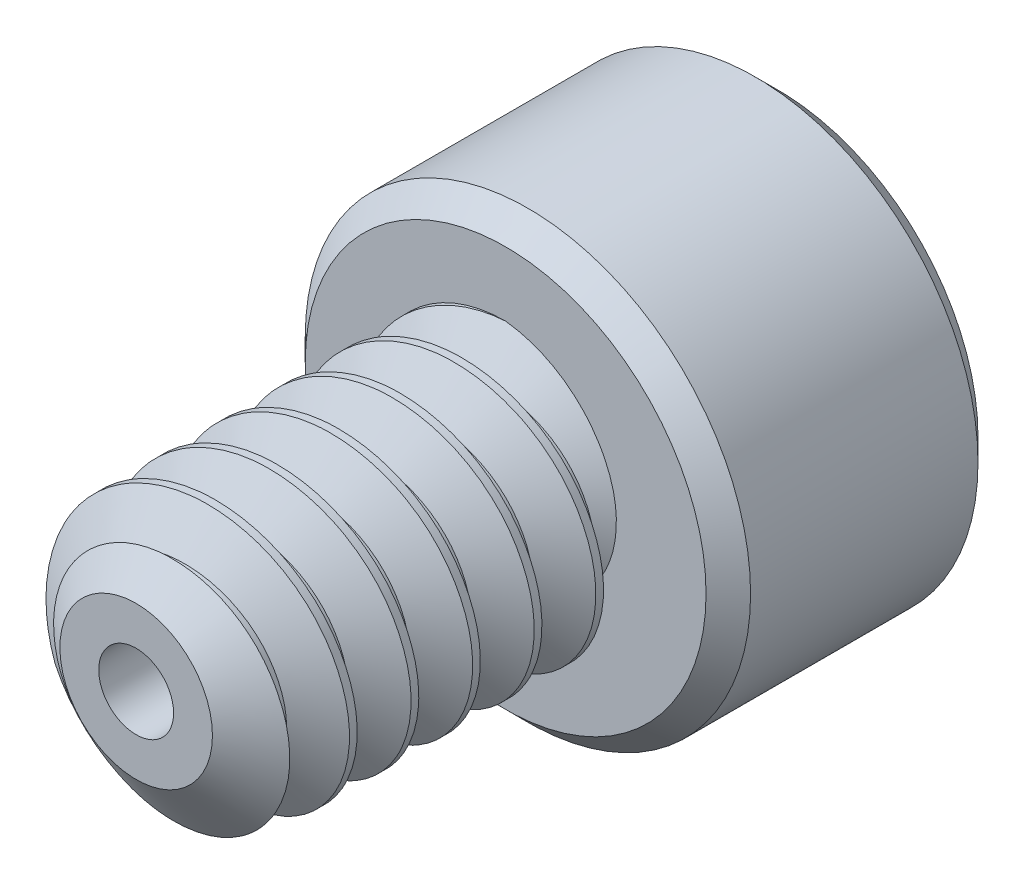
from build123d import *

# Parameters (mm, degrees)
SKETCH1_R          = 1.7526
EXTRUDE1_DEPTH     = 4.7625
CUT_SWEEP1_PITCH   = 0.79375
SKETCH6_R          = 2.8702
EXTRUDE2_DEPTH     = 3.5052
CUT_EXTRUDE1_DEPTH = 2.08359375
CHAMFER1_SIZE      = 0.28702
SKETCH11_R         = 0.4826
CUT_EXTRUDE3_DEPTH = 10.21037238


with BuildPart() as part:
    # Sketch1 → Extrude1 (new body)
    with BuildSketch(Plane.XY):
        Circle(SKETCH1_R)
    extrude(amount=-EXTRUDE1_DEPTH)

    # Cut-Sweep1: the profile of Sketch3 profile screwed along a right-hand helix of 7 turns, 6 arcs to a turn; built about Z, then put on its axis
    cut_sweep1_z = Axis((0, 0, 0), (0, 0, 1))
    cut_sweep1_corners = [(1.7529, 0, -0.694704455), (1.237044252, 0, -0.396875), (1.237044252, 0, -0.29765625), (1.7529, 0, 0.000173205)]
    with BuildLine(mode=Mode.PRIVATE) as cut_sweep1_profile:
        Line(cut_sweep1_corners[0], cut_sweep1_corners[1])
        Line(cut_sweep1_corners[1], cut_sweep1_corners[2])
        Line(cut_sweep1_corners[2], cut_sweep1_corners[3])
        Line(cut_sweep1_corners[3], cut_sweep1_corners[0])
    cut_sweep1_cap = Face(cut_sweep1_profile.wire())
    cut_sweep1_turn_angles = [0, 30, 60, 90, 120, 150, 180, 210, 240, 270, 300, 330, 360]
    cut_sweep1_turn_weights = [1, 0.8660254037844387, 1, 0.8660254037844387, 1, 0.8660254037844387, 1, 0.8660254037844387, 1, 0.8660254037844387, 1, 0.8660254037844387, 1]
    cut_sweep1_turn_rails = [Edge.make_bspline([Vector(p[0], p[1], 0).rotate(cut_sweep1_z, cut_sweep1_turn_angles[k]) / cut_sweep1_turn_weights[k] + Vector(0, 0, p[2] + CUT_SWEEP1_PITCH * cut_sweep1_turn_angles[k] / 360) for k in range(13)], [0, 0, 0, 1, 1, 2, 2, 3, 3, 4, 4, 5, 5, 6, 6, 6], 2, cut_sweep1_turn_weights) for p in cut_sweep1_corners]
    cut_sweep1_turn_sides = [Face.make_surface_from_curves(cut_sweep1_turn_rails[p[0]], cut_sweep1_turn_rails[p[1]]) for p in [(0, 1), (1, 2), (2, 3), (3, 0)]]
    cut_sweep1 = Plane(origin=(0, 0, 0), x_dir=(0, 1, 0), z_dir=(0, 0, -1)) * Solid(Shell([*[p.moved(Location((0, 0, CUT_SWEEP1_PITCH * i))) for i in range(7) for p in cut_sweep1_turn_sides], cut_sweep1_cap, cut_sweep1_cap.rotate(cut_sweep1_z, 2520).moved(Location((0, 0, CUT_SWEEP1_PITCH * 2520 / 360)))]))
    add(cut_sweep1, mode=Mode.SUBTRACT)

    # Sketch4 → Cut-Revolve1 (revolve, cut)
    with BuildSketch(Plane(origin=(0, 0, 0), x_dir=(0, 0, -1), z_dir=(1, 0, 0)), mode=Mode.PRIVATE) as cut_revolve1_sk:
        Polygon((0.538848736, 1.7526), (0, 0.983044252), (0, 1.7526), align=None)
    revolve(cut_revolve1_sk.sketch.rotate(Axis((0, 0, 0), (0, 0, -1)), 261.048315518), axis=Axis((0, 0, 0), (0, 0, -1)), mode=Mode.SUBTRACT)

    # Sketch6 → Extrude2 (add)
    with BuildSketch(Plane(origin=(0, 0, -4.7625), x_dir=(-1, 0, 0), z_dir=(0, 0, -1))):
        Circle(SKETCH6_R)
    extrude(amount=EXTRUDE2_DEPTH)

    # Sketch7 → Cut-Extrude1 (cut)
    with BuildSketch(Plane(origin=(0, 0, -8.2677), x_dir=(-1, 0, 0), z_dir=(0, 0, -1))):
        Polygon((0, 1.603951217), (-1.3890625, 0.801975608), (-1.3890625, -0.801975608), (0, -1.603951217), (1.3890625, -0.801975608), (1.3890625, 0.801975608), align=None)
    extrude(amount=-CUT_EXTRUDE1_DEPTH, mode=Mode.SUBTRACT)

    # Cut-Extrude2 cone 1 section (through the dimple's axis) → Cut-Extrude2 (revolve, cut)
    with BuildSketch(Plane(origin=(0, 0, -8.2677), x_dir=(0, 1, 0), z_dir=(1, 0, 0))):
        Polygon((0, 0), (1.603951217, 0), (0, 1.603951217), align=None)
    revolve(axis=Axis((0, 0, -8.2677), (0, 0, 1)), mode=Mode.SUBTRACT)

    # Chamfer1
    chamfer1_edges = [part.edges().sort_by_distance(p)[0] for p in [
        (2.8702, 0, -4.7625),
        (2.8702, 0, -8.2677),
    ]]
    chamfer(chamfer1_edges, length=CHAMFER1_SIZE)

    # Sketch11 → Cut-Extrude3 (cut, through all)
    with BuildSketch(Plane.XY):
        Circle(SKETCH11_R)
    extrude(amount=-CUT_EXTRUDE3_DEPTH, mode=Mode.SUBTRACT)


solid = part.part
